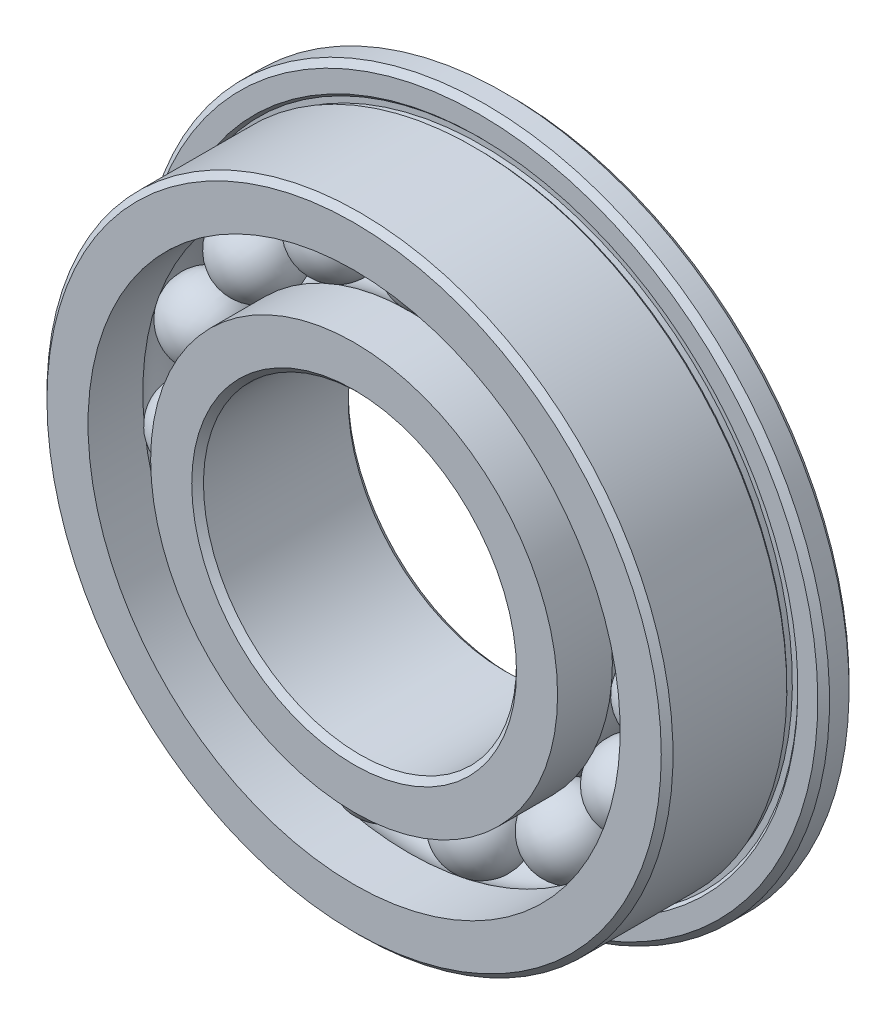
from build123d import *

# Parameters (mm, degrees)
FILLET1_SIZE      = 0.1125
FILLET2_SIZE      = 0.1125
CIRPATTERN3_COUNT = 15


with BuildPart() as part:
    # Sketch2 → Revolve1 (revolve)
    with BuildSketch(Plane(origin=(0, 0, 0), x_dir=(0, 0, -1), z_dir=(1, 0, 0))):
        with BuildLine():
            Line((1.5, 6.6), (0.9, 6.6))
            Line((0.9, 6.6), (0.9, 6.106066017))
            Line((0.9, 6.106066017), (0.953033009, 6.053033009))
            Line((0.953033009, 6.053033009), (0.953033009, 5.946966991))
            Line((0.953033009, 5.946966991), (0.846966991, 5.946966991))
            Line((0.846966991, 5.946966991), (0.793933983, 6))
            Line((0.793933983, 6), (-1.5, 6))
            Line((-1.5, 6), (-1.5, 5.1))
            Line((-1.5, 5.1), (-0.45, 5.1))
            ThreePointArc((-0.45, 5.1), (0, 5.25), (0.45, 5.1))
            Line((0.45, 5.1), (1.5, 5.1))
            Line((1.5, 5.1), (1.5, 6.6))
        make_face()
        with BuildLine():
            Line((1.5, 3), (-1.5, 3))
            Line((-1.5, 3), (-1.5, 3.9))
            Line((-1.5, 3.9), (-0.45, 3.9))
            ThreePointArc((-0.45, 3.9), (0, 3.75), (0.45, 3.9))
            Line((0.45, 3.9), (1.5, 3.9))
            Line((1.5, 3.9), (1.5, 3))
        make_face()
    revolve(axis=Axis((0, 0, 0), (0, 0, -1)))

    # Fillet1
    fillet1_edges = [part.edges().sort_by_distance(p)[0] for p in [
        (0, -6.6, -1.5),
        (0, -6.6, -0.9),
        (0, -6, 1.5),
    ]]
    chamfer(fillet1_edges, length=FILLET1_SIZE)

    # Fillet2
    fillet2_edges = [part.edges().sort_by_distance(p)[0] for p in [
        (0, -3, -1.5),
        (0, -3, 1.5),
    ]]
    chamfer(fillet2_edges, length=FILLET2_SIZE)


with BuildPart() as body_2:
    # Sketch7 → Revolve3 (revolve)
    with BuildSketch(Plane.XY):
        with BuildLine():
            Line((0, 5.25), (0, 3.75))
            ThreePointArc((0, 3.75), (-0.75, 4.5), (0, 5.25))
        make_face()
    revolve(axis=Axis((0, 5.25, 0), (0, -1, 0)))


with BuildPart() as cirpattern3_1:
    # CirPattern3: pattern copy
    add(body_2.part.rotate(Axis((0, 0, 0), (0, 0, -1)), 1 * 360 / CIRPATTERN3_COUNT))


with BuildPart() as cirpattern3_2:
    # CirPattern3: pattern copy
    add(body_2.part.rotate(Axis((0, 0, 0), (0, 0, -1)), 2 * 360 / CIRPATTERN3_COUNT))


with BuildPart() as cirpattern3_3:
    # CirPattern3: pattern copy
    add(body_2.part.rotate(Axis((0, 0, 0), (0, 0, -1)), 3 * 360 / CIRPATTERN3_COUNT))


with BuildPart() as cirpattern3_4:
    # CirPattern3: pattern copy
    add(body_2.part.rotate(Axis((0, 0, 0), (0, 0, -1)), 4 * 360 / CIRPATTERN3_COUNT))


with BuildPart() as cirpattern3_5:
    # CirPattern3: pattern copy
    add(body_2.part.rotate(Axis((0, 0, 0), (0, 0, -1)), 5 * 360 / CIRPATTERN3_COUNT))


with BuildPart() as cirpattern3_6:
    # CirPattern3: pattern copy
    add(body_2.part.rotate(Axis((0, 0, 0), (0, 0, -1)), 6 * 360 / CIRPATTERN3_COUNT))


with BuildPart() as cirpattern3_7:
    # CirPattern3: pattern copy
    add(body_2.part.rotate(Axis((0, 0, 0), (0, 0, -1)), 7 * 360 / CIRPATTERN3_COUNT))


with BuildPart() as cirpattern3_8:
    # CirPattern3: pattern copy
    add(body_2.part.rotate(Axis((0, 0, 0), (0, 0, -1)), 8 * 360 / CIRPATTERN3_COUNT))


with BuildPart() as cirpattern3_9:
    # CirPattern3: pattern copy
    add(body_2.part.rotate(Axis((0, 0, 0), (0, 0, -1)), 9 * 360 / CIRPATTERN3_COUNT))


with BuildPart() as cirpattern3_10:
    # CirPattern3: pattern copy
    add(body_2.part.rotate(Axis((0, 0, 0), (0, 0, -1)), 10 * 360 / CIRPATTERN3_COUNT))


with BuildPart() as cirpattern3_11:
    # CirPattern3: pattern copy
    add(body_2.part.rotate(Axis((0, 0, 0), (0, 0, -1)), 11 * 360 / CIRPATTERN3_COUNT))


with BuildPart() as cirpattern3_12:
    # CirPattern3: pattern copy
    add(body_2.part.rotate(Axis((0, 0, 0), (0, 0, -1)), 12 * 360 / CIRPATTERN3_COUNT))


with BuildPart() as cirpattern3_13:
    # CirPattern3: pattern copy
    add(body_2.part.rotate(Axis((0, 0, 0), (0, 0, -1)), 13 * 360 / CIRPATTERN3_COUNT))


with BuildPart() as cirpattern3_14:
    # CirPattern3: pattern copy
    add(body_2.part.rotate(Axis((0, 0, 0), (0, 0, -1)), 14 * 360 / CIRPATTERN3_COUNT))


solid = Compound([part.part, body_2.part, cirpattern3_1.part, cirpattern3_2.part, cirpattern3_3.part, cirpattern3_4.part, cirpattern3_5.part, cirpattern3_6.part, cirpattern3_7.part, cirpattern3_8.part, cirpattern3_9.part, cirpattern3_10.part, cirpattern3_11.part, cirpattern3_12.part, cirpattern3_13.part, cirpattern3_14.part])
